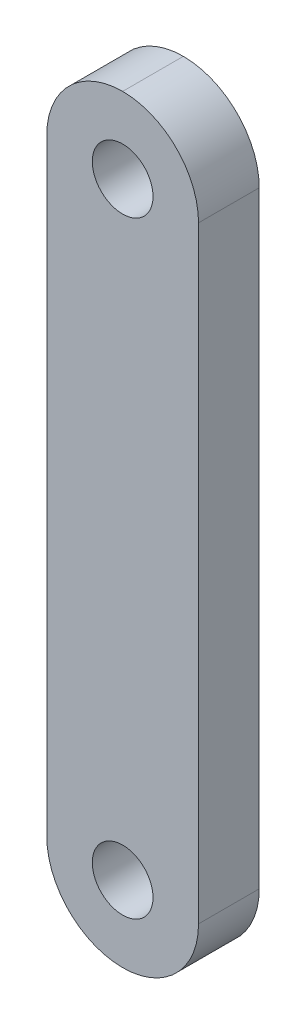
from build123d import *

# Parameters (mm, degrees)
ESQUISSE1_W             = 50
ESQUISSE1_H             = 250
BOSS_EXTRU_1_DEPTH      = 20
ENL_V_MAT_EXTRU_1_REACH = 131.035
ESQUISSE2_R             = 10
CONG_1_R                = 25


with BuildPart() as part:
    # Esquisse1 → Boss.-Extru.1 (new body)
    with BuildSketch(Plane.XY):
        Rectangle(ESQUISSE1_W, ESQUISSE1_H)
    extrude(amount=BOSS_EXTRU_1_DEPTH)

    # Esquisse2 → Enlèv. mat.-Extru.1 (cut, up to next)
    with BuildSketch(Plane.XY.offset(20), mode=Mode.PRIVATE) as enl_v_mat_extru_1_sk1:
        with Locations((0, -100)):
            Circle(ESQUISSE2_R)
    enl_v_mat_extru_1_tool1 = extrude(enl_v_mat_extru_1_sk1.sketch, amount=-ENL_V_MAT_EXTRU_1_REACH, mode=Mode.PRIVATE) & part.part
    # Esquisse2 → Enlèv. mat.-Extru.1 (cut, up to next)
    with BuildSketch(Plane.XY.offset(20), mode=Mode.PRIVATE) as enl_v_mat_extru_1_sk2:
        with Locations((0, 100)):
            Circle(ESQUISSE2_R)
    enl_v_mat_extru_1_tool2 = extrude(enl_v_mat_extru_1_sk2.sketch, amount=-ENL_V_MAT_EXTRU_1_REACH, mode=Mode.PRIVATE) & part.part
    add(enl_v_mat_extru_1_tool1.solids().sort_by_distance((0, -100, 20))[0], mode=Mode.SUBTRACT)
    add(enl_v_mat_extru_1_tool2.solids().sort_by_distance((0, 100, 20))[0], mode=Mode.SUBTRACT)

    # Congé1
    cong_1_edges = [part.edges().sort_by_distance(p)[0] for p in [
        (-25, -125, 10),
        (25, -125, 10),
        (-25, 125, 10),
        (25, 125, 10),
    ]]
    fillet(cong_1_edges, radius=CONG_1_R - 0.0001)  # a hair under: the kernel refuses the full size


solid = part.part
